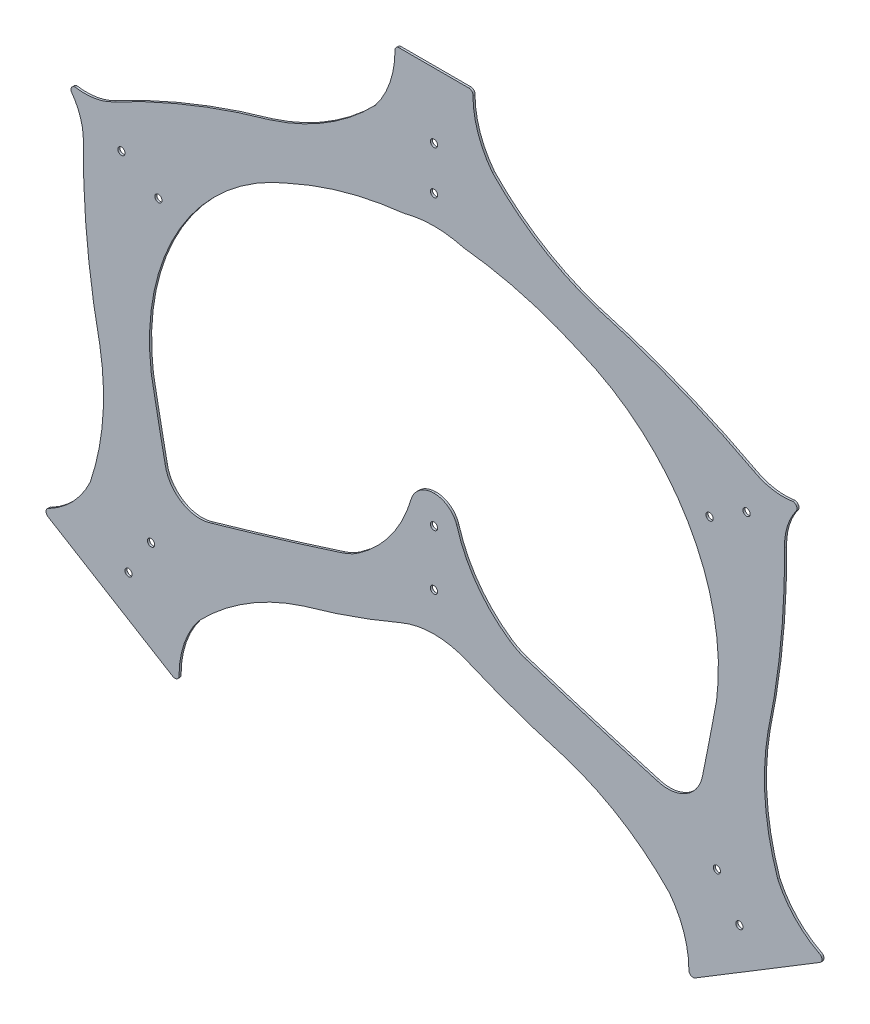
from build123d import *

# Parameters (mm, degrees)
MODEL_R             = 11.1125
BOSS_EXTRUDE1_DEPTH = 6.35


with BuildPart() as part:
    # Model → Boss-Extrude1 (new body)
    with BuildSketch(Plane.XY):
        with BuildLine():
            Line((804.711295337, -736.089913131), (996.642508324, -619.39692931))
            Line((996.642508324, -619.39692931), (1188.573721311, -502.703945489))
            ThreePointArc((1188.573721311, -502.703945489), (1194.758867123, -489.862436249), (1185.549839865, -478.983364356))
            ThreePointArc((1185.549839865, -478.983364356), (1111.079929488, -422.562526425), (1058.637824245, -345.239152843))
            ThreePointArc((1058.637824245, -345.239152843), (1020.031551111, -157.346117732), (1028.959068845, 34.264258802))
            ThreePointArc((1028.959068845, 34.264258802), (1068.187186357, 290.07371902), (1079.751452377, 548.614997913))
            ThreePointArc((1079.751452377, 548.614997913), (1088.280477324, 610.768486477), (1116.750105706, 666.672696221))
            ThreePointArc((1116.750105706, 666.672696221), (1117.882919801, 672.856632498), (1116.002271874, 678.855590659))
            ThreePointArc((1116.002271874, 678.855590659), (1111.541880184, 683.286080657), (1105.530407934, 685.126335268))
            ThreePointArc((1105.530407934, 685.126335268), (1042.796083973, 685.57910921), (983.690688815, 706.611290986))
            ThreePointArc((983.690688815, 706.611290986), (748.834391198, 815.330399748), (503.671951989, 898.232170186))
            ThreePointArc((503.671951989, 898.232170186), (359.58871383, 960.684547874), (231.131181679, 1051.01140673))
            ThreePointArc((231.131181679, 1051.01140673), (205.221467473, 1074.548458843), (180.40576378, 1099.23624859))
            ThreePointArc((180.40576378, 1099.23624859), (135.892617731, 1181.38038005), (120.07448413, 1273.461133488))
            ThreePointArc((120.07448413, 1273.461133488), (117.282668444, 1284.235908033), (107.207932335, 1288.967682928))
            Line((107.207932335, 1288.967682928), (0.843753936, 1288.967682928))
            Line((0.843753936, 1288.967682928), (-0.843753936, 1288.967682928))
            Line((-0.843753936, 1288.967682928), (-107.207932335, 1288.967682928))
            ThreePointArc((-107.207932335, 1288.967682928), (-117.282668443, 1284.235908033), (-120.074484129, 1273.461133488))
            ThreePointArc((-120.074484129, 1273.461133488), (-135.892617731, 1181.38038005), (-180.405763779, 1099.23624859))
            ThreePointArc((-180.405763779, 1099.23624859), (-205.221467473, 1074.548458843), (-231.131181678, 1051.01140673))
            ThreePointArc((-231.131181678, 1051.01140673), (-359.58871383, 960.684547874), (-503.671951989, 898.232170186))
            ThreePointArc((-503.671951989, 898.232170186), (-748.834391198, 815.330399748), (-983.690688815, 706.611290986))
            ThreePointArc((-983.690688815, 706.611290986), (-1042.796083973, 685.57910921), (-1105.530407934, 685.126335268))
            ThreePointArc((-1105.530407934, 685.126335268), (-1111.541880184, 683.286080657), (-1116.002271874, 678.855590659))
            ThreePointArc((-1116.002271874, 678.855590659), (-1117.882919801, 672.856632498), (-1116.750105706, 666.672696221))
            ThreePointArc((-1116.750105706, 666.672696221), (-1088.280477324, 610.768486477), (-1079.751452377, 548.614997913))
            ThreePointArc((-1079.751452377, 548.614997913), (-1068.187186357, 290.073719021), (-1028.959068845, 34.264258804))
            ThreePointArc((-1028.959068845, 34.264258804), (-1020.03155111, -157.346117731), (-1058.637824245, -345.239152843))
            ThreePointArc((-1058.637824245, -345.239152843), (-1111.079929488, -422.562526425), (-1185.549839865, -478.983364356))
            ThreePointArc((-1185.549839865, -478.983364356), (-1194.758867123, -489.862436249), (-1188.57372131, -502.703945489))
            Line((-1188.57372131, -502.703945489), (-996.642508324, -619.39692931))
            Line((-996.642508324, -619.39692931), (-804.711295337, -736.089913131))
            ThreePointArc((-804.711295337, -736.089913131), (-790.46401272, -735.671193301), (-785.043700845, -722.488606018))
            ThreePointArc((-785.043700845, -722.488606018), (-769.225567244, -630.40785258), (-724.712421195, -548.26372112))
            ThreePointArc((-724.712421195, -548.26372112), (-699.896717501, -523.575931373), (-673.987003296, -500.03887926))
            ThreePointArc((-673.987003296, -500.03887926), (-545.529471148, -409.712020406), (-401.446232994, -347.259642719))
            ThreePointArc((-401.446232994, -347.259642719), (-250.263101826, -299.622536779), (-102.53942399, -242.14777694))
            ThreePointArc((-102.53942399, -242.14777694), (-52.33358868, -226.43468649), (0, -221.075338912))
            ThreePointArc((0, -221.075338912), (52.333588681, -226.43468649), (102.53942399, -242.14777694))
            ThreePointArc((102.53942399, -242.14777694), (250.263101826, -299.622536779), (401.446232994, -347.259642719))
            ThreePointArc((401.446232994, -347.259642719), (545.529471148, -409.712020406), (673.987003296, -500.03887926))
            ThreePointArc((673.987003296, -500.03887926), (699.896717501, -523.575931373), (724.712421195, -548.26372112))
            ThreePointArc((724.712421195, -548.26372112), (769.225567244, -630.40785258), (785.043700845, -722.488606019))
            ThreePointArc((785.043700845, -722.488606019), (790.46401272, -735.671193301), (804.711295337, -736.089913131))
        make_face()
        with Locations((-940.667260057, -527.307103468)):
            Circle(MODEL_R, mode=Mode.SUBTRACT)
        with Locations((-871.304594896, -413.180608128)):
            Circle(MODEL_R, mode=Mode.SUBTRACT)
        with Locations((0, -103.091704201)):
            Circle(MODEL_R, mode=Mode.SUBTRACT)
        with Locations((0, 66.675)):
            Circle(MODEL_R, mode=Mode.SUBTRACT)
        with Locations((940.667260057, -527.307103468)):
            Circle(MODEL_R, mode=Mode.SUBTRACT)
        with Locations((871.304594896, -413.180608128)):
            Circle(MODEL_R, mode=Mode.SUBTRACT)
        with Locations((-848.694694017, 516.334245785)):
            Circle(MODEL_R, mode=Mode.SUBTRACT)
        with Locations((-962.637575619, 585.610809155)):
            Circle(MODEL_R, mode=Mode.SUBTRACT)
        with BuildLine():
            Line((-776.899360277, -258.106558838), (-777.017418741, -258.034780026))
            ThreePointArc((-777.017418741, -258.034780026), (-810.997838197, -225.436865996), (-828.001105066, -181.525798811))
            ThreePointArc((-828.001105066, -181.525798811), (-849.713879038, -72.220300498), (-870.432747172, 37.277941579))
            ThreePointArc((-870.432747172, 37.277941579), (-782.31262224, 469.461121563), (-447.930733362, 757.10014859))
            ThreePointArc((-447.930733362, 757.10014859), (-273.580385766, 820.400076239), (-91.337673819, 854.932937253))
            ThreePointArc((-91.337673819, 854.932937253), (-46.078085809, 864.133740316), (0, 867.279386833))
            ThreePointArc((0, 867.279386833), (46.078085809, 864.133740316), (91.337673819, 854.932937253))
            ThreePointArc((91.337673819, 854.932937253), (273.580385766, 820.400076239), (447.930733362, 757.10014859))
            ThreePointArc((447.930733362, 757.10014859), (782.312622241, 469.461121563), (870.432747172, 37.277941579))
            ThreePointArc((870.432747172, 37.277941579), (849.713879038, -72.220300498), (828.001105066, -181.525798811))
            ThreePointArc((828.001105066, -181.525798811), (810.997838197, -225.436865996), (777.017418741, -258.034780026))
            Line((777.017418741, -258.034780026), (776.899360277, -258.106558838))
            ThreePointArc((776.899360277, -258.106558838), (753.952159334, -268.627273319), (729.196843605, -273.570329819))
            ThreePointArc((729.196843605, -273.570329819), (707.076892075, -273.099658025), (685.510596971, -268.159141543))
            ThreePointArc((685.510596971, -268.159141543), (482.687129839, -208.466208916), (280.922595507, -145.286483444))
            ThreePointArc((280.922595507, -145.286483444), (256.247041174, -135.308559365), (233.263609784, -121.884557273))
            ThreePointArc((233.263609784, -121.884557273), (132.05806492, -23.120372866), (70.187868515, 104.037030496))
            ThreePointArc((70.187868515, 104.037030496), (43.358510274, 140.815046773), (0, 154.688637932))
            ThreePointArc((0, 154.688637932), (-43.358510275, 140.815046773), (-70.187868515, 104.037030496))
            ThreePointArc((-70.187868515, 104.037030496), (-132.05806492, -23.120372866), (-233.263609784, -121.884557273))
            ThreePointArc((-233.263609784, -121.884557273), (-256.247041174, -135.308559365), (-280.922595507, -145.286483444))
            ThreePointArc((-280.922595507, -145.286483444), (-482.687129839, -208.466208916), (-685.510596971, -268.159141543))
            ThreePointArc((-685.510596971, -268.159141543), (-707.076892075, -273.099658025), (-729.196843605, -273.570329819))
            ThreePointArc((-729.196843605, -273.570329819), (-753.952159334, -268.627273319), (-776.899360277, -258.106558838))
        make_face(mode=Mode.SUBTRACT)
        with Locations((848.694694017, 516.334245785)):
            Circle(MODEL_R, mode=Mode.SUBTRACT)
        with Locations((962.637575619, 585.610809155)):
            Circle(MODEL_R, mode=Mode.SUBTRACT)
        with Locations((0.146924328, 954.547258793)):
            Circle(MODEL_R, mode=Mode.SUBTRACT)
        with Locations((0.146924328, 1087.897258793)):
            Circle(MODEL_R, mode=Mode.SUBTRACT)
    extrude(amount=BOSS_EXTRUDE1_DEPTH)


solid = part.part
